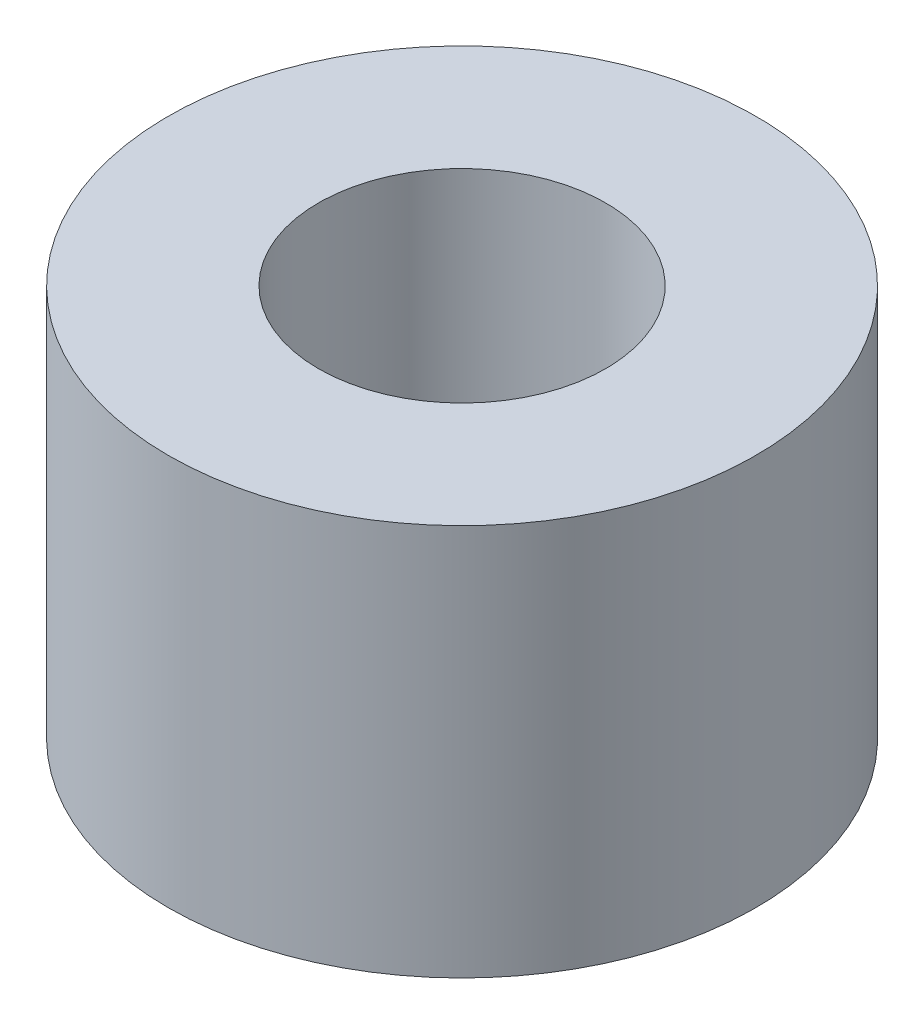
from build123d import *

# Parameters (mm, degrees)
SKETCH1_R           = 2.25
SKETCH1_R_2         = 1.1
BOSS_EXTRUDE1_DEPTH = 3


with BuildPart() as part:
    # Sketch1 → Boss-Extrude1 (new body)
    with BuildSketch(Plane(origin=(0, 0, 0), x_dir=(1, 0, 0), z_dir=(0, 1, 0))):
        Circle(SKETCH1_R)
        Circle(SKETCH1_R_2, mode=Mode.SUBTRACT)
    extrude(amount=BOSS_EXTRUDE1_DEPTH)


solid = part.part
